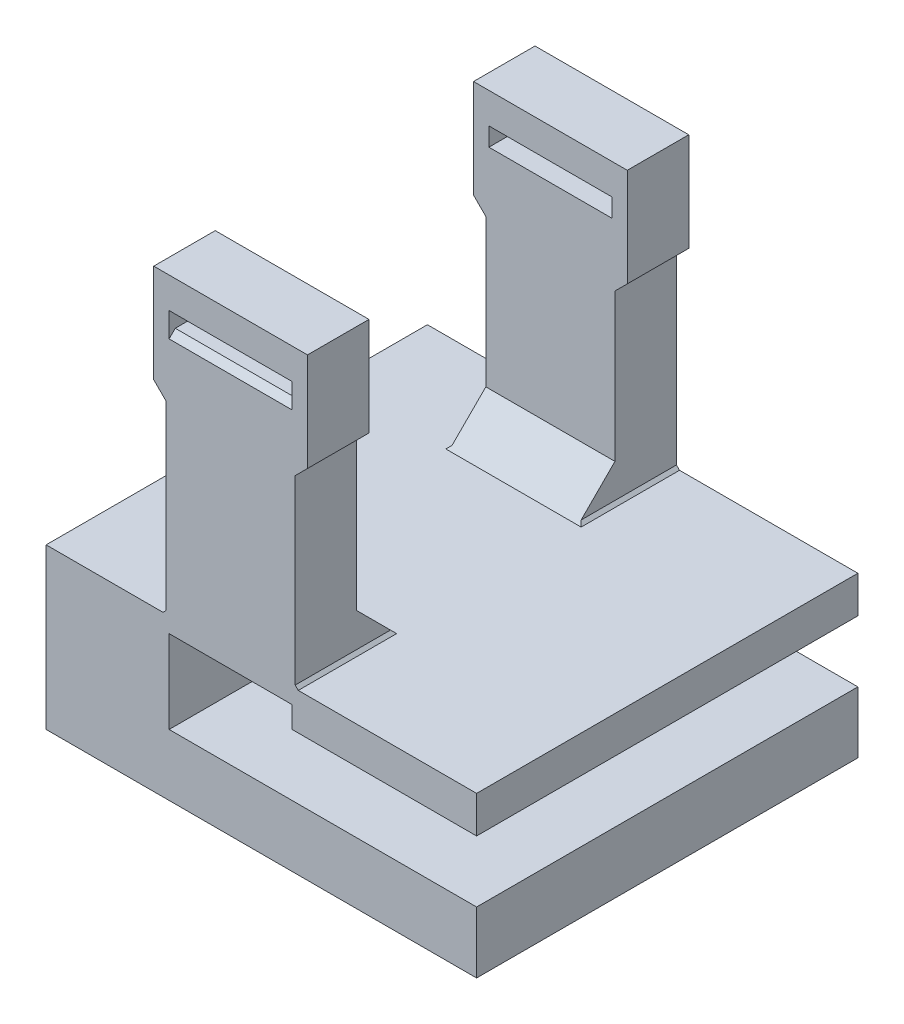
from build123d import *

# Parameters (mm, degrees)
ESBO_O1_W                = 40
ESBO_O1_H                = 62
RESSALTO_EXTRUS_O1_DEPTH = 6
ESBO_O2_W                = 21
ESBO_O2_H                = 10
RESSALTO_EXTRUS_O2_DEPTH = 48
CHANFRO1_SIZE            = 6
ESBO_O3_W                = 10
ESBO_O3_H                = 62
RESSALTO_EXTRUS_O3_DEPTH = 20
ESBO_O4_W                = 62
ESBO_O4_H                = 10
RESSALTO_EXTRUS_O4_DEPTH = 50
ESBO_O5_W                = 2
ESBO_O5_H                = 13
RESSALTO_EXTRUS_O5_DEPTH = 10
ESBO_O6_W                = 20
ESBO_O6_H                = 3
ESBO_O6_H_2              = 2.5
CORTE_EXTRUS_O1_DEPTH    = 92.433035605
CHANFRO2_SIZE            = 1
CHANFRO3_SIZE            = 5
ESBO_O7_W                = 62
ESBO_O7_H                = 26
RESSALTO_EXTRUS_O6_DEPTH = 10
CHANFRO4_SIZE            = 0.5
ESBO_O8_W                = 62
ESBO_O8_H                = 6
RESSALTO_EXTRUS_O7_DEPTH = 20


with BuildPart() as part:
    # Esboço1 → Ressalto-extrusão1 (new body)
    with BuildSketch(Plane(origin=(0, 0, 0), x_dir=(1, 0, 0), z_dir=(0, 1, 0))):
        Rectangle(ESBO_O1_W, ESBO_O1_H)
    extrude(amount=RESSALTO_EXTRUS_O1_DEPTH)

    # Esboço2 → Ressalto-extrusão2 (add)
    with BuildSketch(Plane(origin=(0, 6, 0), x_dir=(1, 0, 0), z_dir=(0, 1, 0))):
        with Locations((0, -26)):
            Rectangle(ESBO_O2_W, ESBO_O2_H)
        with Locations((0, 26)):
            Rectangle(ESBO_O2_W, ESBO_O2_H)
    extrude(amount=RESSALTO_EXTRUS_O2_DEPTH)

    # Chanfro1
    chanfro1_edges = [part.edges().sort_by_distance(p)[0] for p in [
        (0, 6, -21),
        (0, 6, 21),
    ]]
    chamfer(chanfro1_edges, length=CHANFRO1_SIZE)

    # Esboço3 → Ressalto-extrusão3 (add)
    with BuildSketch(Plane.XZ):
        with Locations((-15, 0)):
            Rectangle(ESBO_O3_W, ESBO_O3_H)
    extrude(amount=RESSALTO_EXTRUS_O3_DEPTH)

    # Esboço4 → Ressalto-extrusão4 (add)
    with BuildSketch(Plane(origin=(-10, 0, 0), x_dir=(0, 0, -1), z_dir=(1, 0, 0))):
        with Locations((0, -15)):
            Rectangle(ESBO_O4_W, ESBO_O4_H)
    extrude(amount=RESSALTO_EXTRUS_O4_DEPTH)

    # Esboço5 → Ressalto-extrusão5 (add)
    with BuildSketch(Plane.XY.offset(31)):
        with Locations((-11.5, 47.5)):
            Rectangle(ESBO_O5_W, ESBO_O5_H)
        with Locations((11.5, 47.5)):
            Rectangle(ESBO_O5_W, ESBO_O5_H)
    ressalto_extrus_o5 = extrude(amount=-RESSALTO_EXTRUS_O5_DEPTH)

    # Espelhar1: Ressalto-extrusão5 across plane
    add(ressalto_extrus_o5.mirror(Plane.XY))

    # Esboço6 → Corte-extrusão1 (cut, through all)
    with BuildSketch(Plane.XY.offset(31)):
        with Locations((0, 47.5)):
            Rectangle(ESBO_O6_W, ESBO_O6_H)
        with Locations((0, 1.25)):
            Rectangle(ESBO_O6_W, ESBO_O6_H_2)
    extrude(amount=-CORTE_EXTRUS_O1_DEPTH, mode=Mode.SUBTRACT)

    # Chanfro2
    chanfro2_edges = [part.edges().sort_by_distance(p)[0] for p in [
        (0, 46, -31),
        (0, 46, 31),
        (0, 2.5, -31),
        (0, 2.5, 31),
    ]]
    chamfer(chanfro2_edges, length=CHANFRO2_SIZE)

    # Chanfro3
    # the kernel refuses this chamfer: 5 mm, written as the material it adds along each edge
    with BuildSketch(Plane(origin=(-10.5, 41, -31), x_dir=(-0.9996219169112968, 0.027495876610586317, 0), z_dir=(0, 0, 1))) as chanfro3_piece_1_section:
        Polygon((CHANFRO3_SIZE * 0.999621916911, CHANFRO3_SIZE * 0.0274958766106), (-CHANFRO3_SIZE * 0.0274958766106, CHANFRO3_SIZE * 0.999621916911), (0, 0), align=None)
    chanfro3_piece_1 = extrude(amount=10, mode=Mode.PRIVATE)
    chanfro3_piece_1 = split(chanfro3_piece_1, bisect_by=Plane(origin=(-12.5, 38.93054755, -26), z_dir=(1, 0, 0)), keep=Keep.TOP, mode=Mode.PRIVATE)
    add(chanfro3_piece_1)
    with BuildSketch(Plane(origin=(10.5, 41, -31), x_dir=(-0.02749587661058701, -0.9996219169112968, 0), z_dir=(0, 0, 1))) as chanfro3_piece_2_section:
        Polygon((CHANFRO3_SIZE * 0.999621916911, CHANFRO3_SIZE * 0.0274958766106), (-CHANFRO3_SIZE * 0.0274958766106, CHANFRO3_SIZE * 0.999621916911), (0, 0), align=None)
    chanfro3_piece_2 = extrude(amount=10, mode=Mode.PRIVATE)
    chanfro3_piece_2 = split(chanfro3_piece_2, bisect_by=Plane(origin=(12.5, 38.93054755, -26), z_dir=(-1, 0, 0)), keep=Keep.TOP, mode=Mode.PRIVATE)
    add(chanfro3_piece_2)
    with BuildSketch(Plane(origin=(10.5, 41, 31), x_dir=(0.9996219169112968, 0.027495876610586317, 0), z_dir=(0, 0, -1))) as chanfro3_piece_3_section:
        Polygon((CHANFRO3_SIZE * 0.999621916911, CHANFRO3_SIZE * 0.0274958766106), (-CHANFRO3_SIZE * 0.0274958766106, CHANFRO3_SIZE * 0.999621916911), (0, 0), align=None)
    chanfro3_piece_3 = extrude(amount=10, mode=Mode.PRIVATE)
    chanfro3_piece_3 = split(chanfro3_piece_3, bisect_by=Plane(origin=(12.5, 38.93054755, 26), z_dir=(-1, 0, 0)), keep=Keep.TOP, mode=Mode.PRIVATE)
    add(chanfro3_piece_3)
    with BuildSketch(Plane(origin=(-10.5, 41, 31), x_dir=(0.027495876610584936, -0.9996219169112968, 0), z_dir=(0, 0, -1))) as chanfro3_piece_4_section:
        Polygon((CHANFRO3_SIZE * 0.999621916911, CHANFRO3_SIZE * 0.0274958766106), (-CHANFRO3_SIZE * 0.0274958766106, CHANFRO3_SIZE * 0.999621916911), (0, 0), align=None)
    chanfro3_piece_4 = extrude(amount=10, mode=Mode.PRIVATE)
    chanfro3_piece_4 = split(chanfro3_piece_4, bisect_by=Plane(origin=(-12.5, 38.93054755, 26), z_dir=(1, 0, 0)), keep=Keep.TOP, mode=Mode.PRIVATE)
    add(chanfro3_piece_4)

    # Esboço7 → Ressalto-extrusão6 (add)
    with BuildSketch(Plane.ZY.offset(20)):
        with Locations((0, -7)):
            Rectangle(ESBO_O7_W, ESBO_O7_H)
    extrude(amount=RESSALTO_EXTRUS_O6_DEPTH)

    # Chanfro4
    chanfro4_edges = [part.edges().sort_by_distance(p)[0] for p in [
        (-10.5, 6, -23),
        (10.5, 6, -23),
        (10.5, 6, 23),
        (-10.5, 6, 23),
    ]]
    chamfer(chanfro4_edges, length=CHANFRO4_SIZE)

    # Esboço8 → Ressalto-extrusão7 (add)
    with BuildSketch(Plane(origin=(20, 0, 0), x_dir=(0, 0, -1), z_dir=(1, 0, 0))):
        with Locations((0, 3)):
            Rectangle(ESBO_O8_W, ESBO_O8_H)
    extrude(amount=RESSALTO_EXTRUS_O7_DEPTH)


solid = part.part
